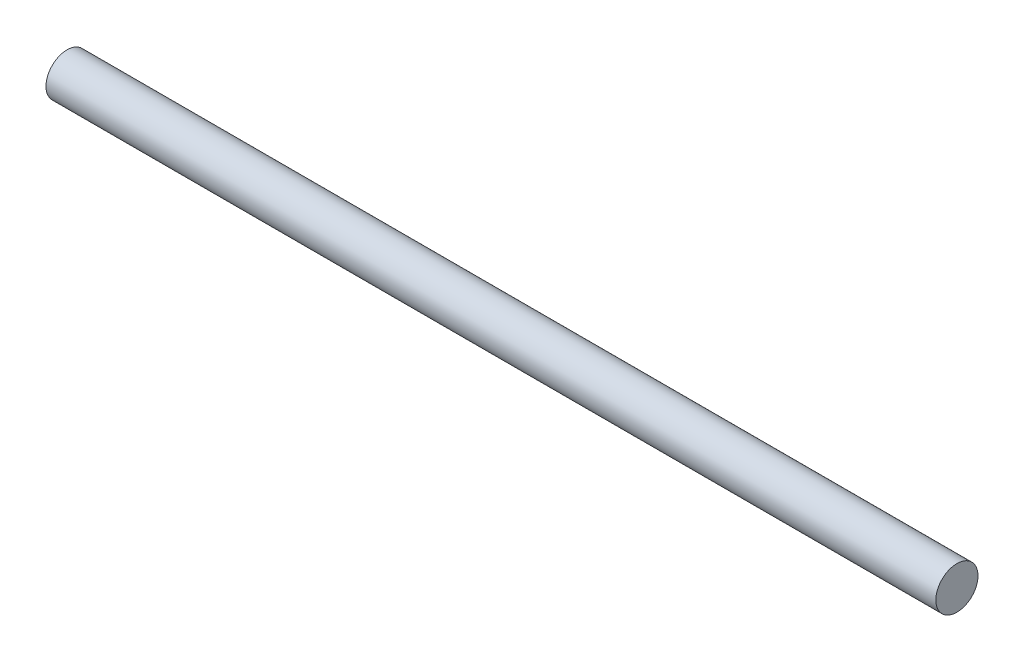
from build123d import *

# Parameters (mm, degrees)
SKETCH2_R           = 5
BOSS_EXTRUDE1_DEPTH = 105.5


with BuildPart() as part:
    # Sketch2 → Boss-Extrude1 (new, symmetric)
    with BuildSketch(Plane(origin=(0, 0, 0), x_dir=(0, 0, -1), z_dir=(1, 0, 0))):
        Circle(SKETCH2_R)
    extrude(amount=BOSS_EXTRUDE1_DEPTH, both=True)


solid = part.part
